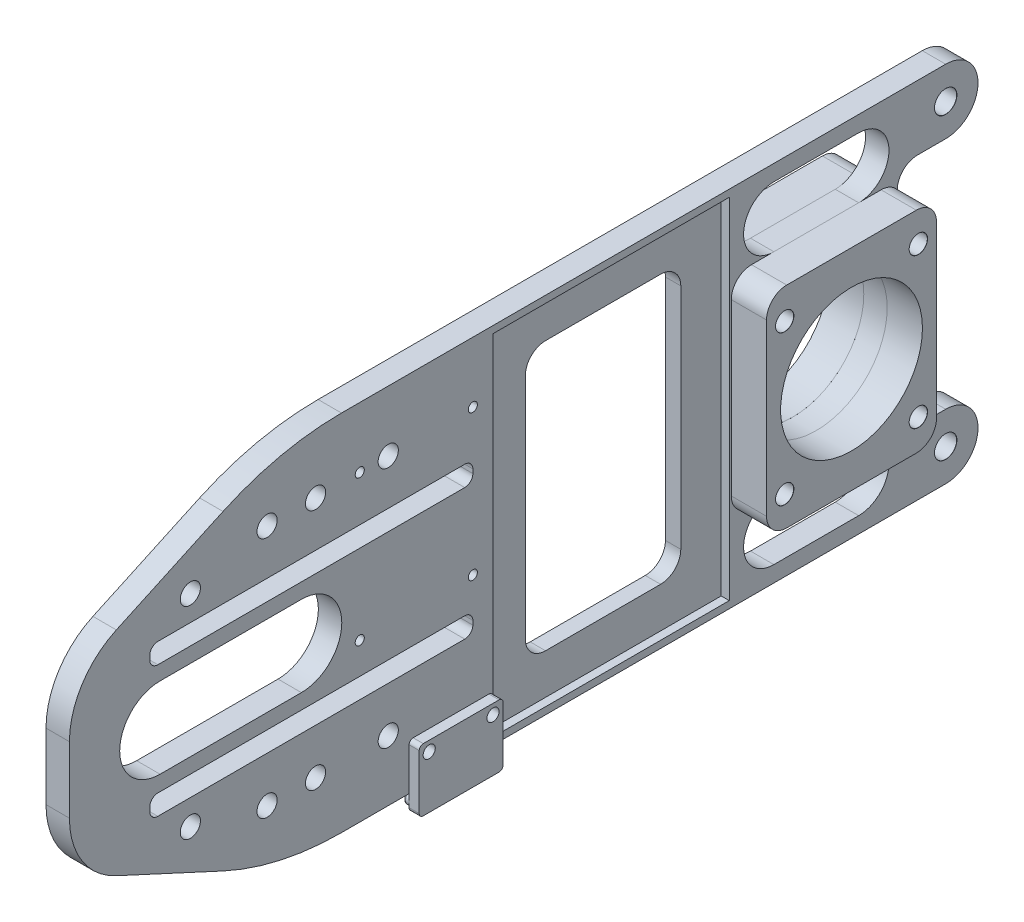
from build123d import *

# Parameters (mm, degrees)
SKETCH1_W                            = 90
SKETCH1_H                            = 225
SKETCH1_R                            = 17.5641
BOSS_EXTRUDE1_DEPTH                  = 2.9
SKETCH2_W                            = 52.1
SKETCH2_H                            = 42.1
BOSS_EXTRUDE2_DEPTH                  = 8.73125
M4_CLEARANCE_HOLE2_AT_2_COUNT        = 2
M4_CLEARANCE_HOLE2_AT_2_PITCH        = 33.1
M4_CLEARANCE_HOLE2_AT_3_COUNT        = 2
M4_CLEARANCE_HOLE2_AT_3_PITCH        = 49.719412708
M4_CLEARANCE_HOLE2_AT_4_COUNT        = 2
M4_CLEARANCE_HOLE2_AT_4_PITCH        = 37.1
SKETCH24_W                           = 52.1
SKETCH24_H                           = 42.1
BOSS_EXTRUDE3_DEPTH                  = 8.73125
TAP_DRILL_FOR_M4X0_7_TAP1_AT_2_COUNT = 2
TAP_DRILL_FOR_M4X0_7_TAP1_AT_2_PITCH = 33.1
TAP_DRILL_FOR_M4X0_7_TAP1_AT_3_COUNT = 2
TAP_DRILL_FOR_M4X0_7_TAP1_AT_3_PITCH = 49.719412708
TAP_DRILL_FOR_M4X0_7_TAP1_AT_4_COUNT = 2
TAP_DRILL_FOR_M4X0_7_TAP1_AT_4_PITCH = 37.1
TAP_DRILL_FOR_M3X0_5_TAP1_AT_2_COUNT = 2
TAP_DRILL_FOR_M3X0_5_TAP1_AT_2_PITCH = 15.8
SKETCH3_R                            = 17.5641
CUT_EXTRUDE3_DEPTH                   = 192.761952447
M5_CLEARANCE_HOLE1_AT_2_COUNT        = 2
M5_CLEARANCE_HOLE1_AT_2_PITCH        = 74
SKETCH14_W                           = 86.5
SKETCH14_H                           = 58.5
CUT_EXTRUDE4_DEPTH                   = 2
FILLET4_R                            = 8
FILLET5_R                            = 5
FILLET6_R                            = 5
SKETCH28_W                           = 15.5
SKETCH28_H                           = 20.75
SKETCH28_R                           = 1.5
BOSS_EXTRUDE4_DEPTH                  = 2.5
FILLET7_R                            = 1
SKETCH29_R                           = 1.5
BOSS_EXTRUDE5_DEPTH                  = 1.5
FILLET8_R                            = 0.5
SKETCH34_W                           = 1.1303
SKETCH34_H                           = 14.53125
TAP_DRILL_FOR_4_40_TAP1_AT_2_COUNT   = 2
TAP_DRILL_FOR_4_40_TAP1_AT_2_PITCH   = 28
TAP_DRILL_FOR_4_40_TAP1_AT_3_COUNT   = 2
TAP_DRILL_FOR_4_40_TAP1_AT_3_PITCH   = 45.607017004
TAP_DRILL_FOR_4_40_TAP1_AT_4_COUNT   = 2
TAP_DRILL_FOR_4_40_TAP1_AT_4_PITCH   = 36
CUT_EXTRUDE7_DEPTH                   = 192.888275701
CUT_EXTRUDE7_DEPTH_BACK              = 192.888275701
CUT_EXTRUDE8_DEPTH                   = 192.888275701
CUT_EXTRUDE11_DEPTH                  = 192.690477337
CUT_EXTRUDE11_DEPTH_BACK             = 192.690477337
SKETCH43_R                           = 2.5
FILLET12_R                           = 70
FILLET13_R                           = 20


with BuildPart() as part:
    # Sketch1 → Boss-Extrude1 (new, symmetric)
    with BuildSketch(Plane.YZ):
        with Locations((0, 72.45)):
            Rectangle(SKETCH1_W, SKETCH1_H)
        Circle(SKETCH1_R, mode=Mode.SUBTRACT)
    extrude(amount=BOSS_EXTRUDE1_DEPTH, both=True)


with BuildPart() as body_2:
    # Sketch2 → Boss-Extrude2 (new body)
    with BuildSketch(Plane.YZ.offset(2.9)):
        Rectangle(SKETCH2_W, SKETCH2_H)
    extrude(amount=BOSS_EXTRUDE2_DEPTH)


with BuildPart() as m4_clearance_hole2_tool:
    # Sketch23 → M4 Clearance Hole2 (revolve)
    with BuildSketch(Plane(origin=(11.63125, -18.55, 16.55), x_dir=(0, 0, -1), z_dir=(0, 1, 0))):
        Polygon((0, 0), (0, 14.53125), (2.25, 14.53125), (2.25, 0.025), (2.275, 0), align=None)
    m4_clearance_hole2 = revolve(axis=Axis((17.98125, -18.55, 16.55), (-1, 0, 0)))


with BuildPart() as part_1:
    add(part.part)

    # M4 Clearance Hole2: cut by m4_clearance_hole2_tool
    add(m4_clearance_hole2_tool.part, mode=Mode.SUBTRACT)


with BuildPart() as body_2_1:
    add(body_2.part)

    # M4 Clearance Hole2: cut by m4_clearance_hole2_tool
    add(m4_clearance_hole2_tool.part, mode=Mode.SUBTRACT)


with BuildPart() as m4_clearance_hole2_at_2_tool:
    # M4 Clearance Hole2 at 2: M4 Clearance Hole2 ×2
    with Locations(*[(0, 0, -i * M4_CLEARANCE_HOLE2_AT_2_PITCH) for i in range(1, M4_CLEARANCE_HOLE2_AT_2_COUNT)]):
        add(m4_clearance_hole2)


with BuildPart() as part_2:
    add(part_1.part)

    # M4 Clearance Hole2 at 2: cut by m4_clearance_hole2_at_2_tool
    add(m4_clearance_hole2_at_2_tool.part, mode=Mode.SUBTRACT)


with BuildPart() as body_2_2:
    add(body_2_1.part)

    # M4 Clearance Hole2 at 2: cut by m4_clearance_hole2_at_2_tool
    add(m4_clearance_hole2_at_2_tool.part, mode=Mode.SUBTRACT)


with BuildPart() as m4_clearance_hole2_at_3_tool:
    # M4 Clearance Hole2 at 3: M4 Clearance Hole2 ×2
    with Locations(*[Vector(0, 0.7461874141213228, -0.6657359409006949) * (i * M4_CLEARANCE_HOLE2_AT_3_PITCH) for i in range(1, M4_CLEARANCE_HOLE2_AT_3_COUNT)]):
        add(m4_clearance_hole2)


with BuildPart() as part_3:
    add(part_2.part)

    # M4 Clearance Hole2 at 3: cut by m4_clearance_hole2_at_3_tool
    add(m4_clearance_hole2_at_3_tool.part, mode=Mode.SUBTRACT)


with BuildPart() as body_2_3:
    add(body_2_2.part)

    # M4 Clearance Hole2 at 3: cut by m4_clearance_hole2_at_3_tool
    add(m4_clearance_hole2_at_3_tool.part, mode=Mode.SUBTRACT)


with BuildPart() as m4_clearance_hole2_at_4_tool:
    # M4 Clearance Hole2 at 4: M4 Clearance Hole2 ×2
    with Locations(*[(0, i * M4_CLEARANCE_HOLE2_AT_4_PITCH, 0) for i in range(1, M4_CLEARANCE_HOLE2_AT_4_COUNT)]):
        add(m4_clearance_hole2)


with BuildPart() as part_4:
    add(part_3.part)

    # M4 Clearance Hole2 at 4: cut by m4_clearance_hole2_at_4_tool
    add(m4_clearance_hole2_at_4_tool.part, mode=Mode.SUBTRACT)

    # Sketch10 → Tap Drill for M3x0.5 Tap1 (revolve, cut)
    with BuildSketch(Plane(origin=(2.9, -36, 98.35), x_dir=(0, 0, -1), z_dir=(0, 1, 0))):
        Polygon((0, 0), (0, 14.53125), (1.25, 14.53125), (1.25, 0.025), (1.275, 0), align=None)
    tap_drill_for_m3x0_5_tap1 = revolve(axis=Axis((9.25, -36, 98.35), (-1, 0, 0)), mode=Mode.SUBTRACT)

    # Tap Drill for M3x0.5 Tap1 at 2: Tap Drill for M3x0.5 Tap1 ×2
    with Locations(*[(0, 0, -i * TAP_DRILL_FOR_M3X0_5_TAP1_AT_2_PITCH) for i in range(1, TAP_DRILL_FOR_M3X0_5_TAP1_AT_2_COUNT)]):
        add(tap_drill_for_m3x0_5_tap1, mode=Mode.SUBTRACT)

    # Sketch12 → M5 Clearance Hole1 (revolve, cut)
    with BuildSketch(Plane(origin=(2.9, -37, -32.05), x_dir=(0, 0, -1), z_dir=(0, 1, 0))):
        Polygon((0, 0), (0, 14.53125), (2.75, 14.53125), (2.75, 0.025), (2.775, 0), align=None)
    m5_clearance_hole1 = revolve(axis=Axis((9.25, -37, -32.05), (-1, 0, 0)), mode=Mode.SUBTRACT)

    # M5 Clearance Hole1 at 2: M5 Clearance Hole1 ×2
    with Locations(*[(0, i * M5_CLEARANCE_HOLE1_AT_2_PITCH, 0) for i in range(1, M5_CLEARANCE_HOLE1_AT_2_COUNT)]):
        add(m5_clearance_hole1, mode=Mode.SUBTRACT)

    # Sketch14 → Cut-Extrude4 (cut)
    with BuildSketch(Plane.YZ.offset(2.9)):
        with Locations((0, 50.8)):
            Rectangle(SKETCH14_W, SKETCH14_H)
    extrude(amount=-CUT_EXTRUDE4_DEPTH, mode=Mode.SUBTRACT)

    # Fillet4
    fillet4_edges = [part_4.edges().sort_by_distance(p)[0] for p in [
        (0, 45, -40.05),
        (0, -45, -40.05),
        (0, 45, 184.95),
        (0, -45, 184.95),
    ]]
    fillet(fillet4_edges, radius=FILLET4_R)

    # Sketch34 → Tap Drill for #4-40 Tap1 (revolve, cut)
    with BuildSketch(Plane(origin=(2.9, -6, 113.05), x_dir=(0, 0, -1), z_dir=(0, 1, 0))):
        with Locations((0.56515, 7.265625)):
            Rectangle(SKETCH34_W, SKETCH34_H)
    tap_drill_for_4_40_tap1 = revolve(axis=Axis((9.25, -6, 113.05), (-1, 0, 0)), mode=Mode.SUBTRACT)

    # Tap Drill for #4-40 Tap1 at 2: Tap Drill for #4-40 Tap1 ×2
    with Locations(*[(0, 0, -i * TAP_DRILL_FOR_4_40_TAP1_AT_2_PITCH) for i in range(1, TAP_DRILL_FOR_4_40_TAP1_AT_2_COUNT)]):
        add(tap_drill_for_4_40_tap1, mode=Mode.SUBTRACT)

    # Tap Drill for #4-40 Tap1 at 3: Tap Drill for #4-40 Tap1 ×2
    with Locations(*[Vector(0, 0.7893522173763263, -0.6139406135149206) * (i * TAP_DRILL_FOR_4_40_TAP1_AT_3_PITCH) for i in range(1, TAP_DRILL_FOR_4_40_TAP1_AT_3_COUNT)]):
        add(tap_drill_for_4_40_tap1, mode=Mode.SUBTRACT)

    # Tap Drill for #4-40 Tap1 at 4: Tap Drill for #4-40 Tap1 ×2
    with Locations(*[(0, i * TAP_DRILL_FOR_4_40_TAP1_AT_4_PITCH, 0) for i in range(1, TAP_DRILL_FOR_4_40_TAP1_AT_4_COUNT)]):
        add(tap_drill_for_4_40_tap1, mode=Mode.SUBTRACT)

    # Sketch37 → Cut-Extrude7 (cut, two sides: drawn at the far end of the back side and taken through both)
    with BuildSketch(Plane.YZ.offset(2.9).offset(-CUT_EXTRUDE7_DEPTH_BACK)):
        with BuildLine():
            Line((-16.75, 165.05), (-15.75, 165.05))
            ThreePointArc((-15.75, 165.05), (-14.335786438, 164.464213562), (-13.75, 163.05))
            Line((-13.75, 163.05), (-13.75, 87.05))
            ThreePointArc((-13.75, 87.05), (-14.335786438, 85.635786438), (-15.75, 85.05))
            Line((-15.75, 85.05), (-16.75, 85.05))
            ThreePointArc((-16.75, 85.05), (-18.164213562, 85.635786438), (-18.75, 87.05))
            Line((-18.75, 87.05), (-18.75, 163.05))
            ThreePointArc((-18.75, 163.05), (-18.164213562, 164.464213562), (-16.75, 165.05))
        make_face()
        with BuildLine():
            Line((13.75, 163.05), (13.75, 87.05))
            ThreePointArc((13.75, 87.05), (14.335786438, 85.635786438), (15.75, 85.05))
            Line((15.75, 85.05), (16.75, 85.05))
            ThreePointArc((16.75, 85.05), (18.164213562, 85.635786438), (18.75, 87.05))
            Line((18.75, 87.05), (18.75, 163.05))
            ThreePointArc((18.75, 163.05), (18.164213562, 164.464213562), (16.75, 165.05))
            Line((16.75, 165.05), (15.75, 165.05))
            ThreePointArc((15.75, 165.05), (14.335786438, 164.464213562), (13.75, 163.05))
        make_face()
    extrude(amount=CUT_EXTRUDE7_DEPTH + CUT_EXTRUDE7_DEPTH_BACK, mode=Mode.SUBTRACT)

    # Sketch38 → Cut-Extrude8 (cut, through all)
    with BuildSketch(Plane.YZ.offset(2.9)):
        with BuildLine():
            ThreePointArc((-33.25, 36.55), (-31.785533906, 33.014466094), (-28.25, 31.55))
            Line((-28.25, 31.55), (28.25, 31.55))
            ThreePointArc((28.25, 31.55), (31.785533906, 33.014466094), (33.25, 36.55))
            Line((33.25, 36.55), (33.25, 65.05))
            ThreePointArc((33.25, 65.05), (31.785533906, 68.585533906), (28.25, 70.05))
            Line((28.25, 70.05), (-28.25, 70.05))
            ThreePointArc((-28.25, 70.05), (-31.785533906, 68.585533906), (-33.25, 65.05))
            Line((-33.25, 65.05), (-33.25, 36.55))
        make_face()
        with BuildLine():
            ThreePointArc((-24, -20.05), (-27.535533906, -21.514466094), (-29, -25.05))
            Line((-29, -25.05), (-29, -32.05))
            ThreePointArc((-29, -32.05), (-31.343145751, -37.706854249), (-37, -40.05))
            Line((-37, -40.05), (37, -40.05))
            ThreePointArc((37, -40.05), (31.343145751, -37.706854249), (29, -32.05))
            Line((29, -32.05), (29, -25.05))
            ThreePointArc((29, -25.05), (27.535533906, -21.514466094), (24, -20.05))
            Line((24, -20.05), (-24, -20.05))
        make_face()
    extrude(amount=-CUT_EXTRUDE8_DEPTH, mode=Mode.SUBTRACT)

    # Sketch43 → Cut-Extrude11 (cut, two sides: drawn at the far end of the back side and taken through both)
    with BuildSketch(Plane.YZ.offset(-CUT_EXTRUDE11_DEPTH_BACK)):
        with Locations((-25, 155)):
            Circle(SKETCH43_R)
        with Locations((-30, 136)):
            Circle(SKETCH43_R)
        with Locations((-30, 106)):
            Circle(SKETCH43_R)
        with Locations((-30, 124)):
            Circle(SKETCH43_R)
        with Locations((30, 124)):
            Circle(SKETCH43_R)
        with Locations((30, 106)):
            Circle(SKETCH43_R)
        with Locations((30, 136)):
            Circle(SKETCH43_R)
        with Locations((25, 155)):
            Circle(SKETCH43_R)
        with BuildLine():
            Line((-26.05, 10.5), (-26.05, -10.5))
            ThreePointArc((-26.05, -10.5), (-33.55, -18), (-41.05, -10.5))
            Line((-41.05, -10.5), (-41.05, 10.5))
            ThreePointArc((-41.05, 10.5), (-33.55, 18), (-26.05, 10.5))
        make_face()
        with BuildLine():
            Line((10, 162.5), (10, 127.5))
            ThreePointArc((10, 127.5), (0, 117.5), (-10, 127.5))
            Line((-10, 127.5), (-10, 162.5))
            ThreePointArc((-10, 162.5), (0, 172.5), (10, 162.5))
        make_face()
        with BuildLine():
            Line((26.05, 10.5), (26.05, -10.5))
            ThreePointArc((26.05, -10.5), (33.55, -18), (41.05, -10.5))
            Line((41.05, -10.5), (41.05, 10.5))
            ThreePointArc((41.05, 10.5), (33.55, 18), (26.05, 10.5))
        make_face()
        Polygon((-45, 132.95), (-21, 184.95), (-45, 184.95), align=None)
        Polygon((21, 184.95), (45, 184.95), (45, 132.95), align=None)
    extrude(amount=CUT_EXTRUDE11_DEPTH + CUT_EXTRUDE11_DEPTH_BACK, mode=Mode.SUBTRACT)

    # Fillet12
    fillet12_edges = [part_4.edges().sort_by_distance(p)[0] for p in [
        (0, 45, 132.95),
        (0, -45, 132.95),
    ]]
    fillet(fillet12_edges, radius=FILLET12_R)

    # Fillet13
    fillet13_edges = [part_4.edges().sort_by_distance(p)[0] for p in [
        (0, 21, 184.95),
        (0, -21, 184.95),
    ]]
    fillet(fillet13_edges, radius=FILLET13_R)


with BuildPart() as body_2_4:
    add(body_2_3.part)

    # M4 Clearance Hole2 at 4: cut by m4_clearance_hole2_at_4_tool
    add(m4_clearance_hole2_at_4_tool.part, mode=Mode.SUBTRACT)


with BuildPart() as body_3:
    # Sketch24 → Boss-Extrude3 (new body)
    with BuildSketch(Plane(origin=(-2.9, 0, 0), x_dir=(0, -1, 0), z_dir=(-1, 0, 0))):
        Rectangle(SKETCH24_W, SKETCH24_H)
    extrude(amount=BOSS_EXTRUDE3_DEPTH)

    # Sketch27 → Tap Drill for M4x0.7 Tap1 (revolve, cut)
    with BuildSketch(Plane(origin=(-11.63125, 18.55, 16.55), x_dir=(0, 0, 1), z_dir=(0, 1, 0))):
        Polygon((0, 0), (0, 9.722670021), (1.65, 8.73125), (1.65, 0.025), (1.675, 0), align=None)
    tap_drill_for_m4x0_7_tap1 = revolve(axis=Axis((-17.98125, 18.55, 16.55), (1, 0, 0)), mode=Mode.SUBTRACT)

    # Tap Drill for M4x0.7 Tap1 at 2: Tap Drill for M4x0.7 Tap1 ×2
    with Locations(*[(0, 0, -i * TAP_DRILL_FOR_M4X0_7_TAP1_AT_2_PITCH) for i in range(1, TAP_DRILL_FOR_M4X0_7_TAP1_AT_2_COUNT)]):
        add(tap_drill_for_m4x0_7_tap1, mode=Mode.SUBTRACT)

    # Tap Drill for M4x0.7 Tap1 at 3: Tap Drill for M4x0.7 Tap1 ×2
    with Locations(*[Vector(0, -0.7461874141213228, -0.6657359409006949) * (i * TAP_DRILL_FOR_M4X0_7_TAP1_AT_3_PITCH) for i in range(1, TAP_DRILL_FOR_M4X0_7_TAP1_AT_3_COUNT)]):
        add(tap_drill_for_m4x0_7_tap1, mode=Mode.SUBTRACT)

    # Tap Drill for M4x0.7 Tap1 at 4: Tap Drill for M4x0.7 Tap1 ×2
    with Locations(*[(0, -i * TAP_DRILL_FOR_M4X0_7_TAP1_AT_4_PITCH, 0) for i in range(1, TAP_DRILL_FOR_M4X0_7_TAP1_AT_4_COUNT)]):
        add(tap_drill_for_m4x0_7_tap1, mode=Mode.SUBTRACT)


with BuildPart() as cut_extrude3_tool:
    # Sketch3 → Cut-Extrude3 (new, through all)
    with BuildSketch(Plane.YZ.offset(11.63125)):
        Circle(SKETCH3_R)
    extrude(amount=-CUT_EXTRUDE3_DEPTH)


with BuildPart() as body_2_5:
    add(body_2_4.part)

    # Cut-Extrude3: cut by cut_extrude3_tool
    add(cut_extrude3_tool.part, mode=Mode.SUBTRACT)

    # Fillet6
    fillet6_edges = [body_2_5.edges().sort_by_distance(p)[0] for p in [
        (7.265625, -26.05, 21.05),
        (7.265625, 26.05, -21.05),
        (7.265625, -26.05, -21.05),
        (7.265625, 26.05, 21.05),
    ]]
    fillet(fillet6_edges, radius=FILLET6_R)


with BuildPart() as body_3_1:
    add(body_3.part)

    # Cut-Extrude3: cut by cut_extrude3_tool
    add(cut_extrude3_tool.part, mode=Mode.SUBTRACT)

    # Fillet5
    fillet5_edges = [body_3_1.edges().sort_by_distance(p)[0] for p in [
        (-7.265625, -26.05, 21.05),
        (-7.265625, -26.05, -21.05),
        (-7.265625, 26.05, -21.05),
        (-7.265625, 26.05, 21.05),
    ]]
    fillet(fillet5_edges, radius=FILLET5_R)


with BuildPart() as body_4:
    # Sketch28 → Boss-Extrude4 (new body)
    with BuildSketch(Plane.YZ.offset(2.9)):
        with Locations((-41.275, 90.45)):
            Rectangle(SKETCH28_W, SKETCH28_H)
        with Locations((-36, 82.55)):
            Circle(SKETCH28_R, mode=Mode.SUBTRACT)
        with Locations((-36, 98.35)):
            Circle(SKETCH28_R, mode=Mode.SUBTRACT)
    extrude(amount=BOSS_EXTRUDE4_DEPTH)

    # Fillet7
    fillet7_edges = [body_4.edges().sort_by_distance(p)[0] for p in [
        (4.15, -33.525, 100.825),
        (4.15, -33.525, 80.075),
        (4.15, -49.025, 80.075),
        (4.15, -49.025, 100.825),
    ]]
    fillet(fillet7_edges, radius=FILLET7_R)

    # Sketch29 → Boss-Extrude5 (add)
    with BuildSketch(Plane(origin=(2.9, 0, 0), x_dir=(0, -1, 0), z_dir=(-1, 0, 0))):
        with Locations((47.025, 99.2)):
            Circle(SKETCH29_R)
        with Locations((47.025, 95.7)):
            Circle(SKETCH29_R)
        with Locations((47.025, 92.2)):
            Circle(SKETCH29_R)
        with Locations((47.025, 88.7)):
            Circle(SKETCH29_R)
        with Locations((47.025, 85.2)):
            Circle(SKETCH29_R)
        with Locations((47.025, 81.7)):
            Circle(SKETCH29_R)
    extrude(amount=BOSS_EXTRUDE5_DEPTH)

    # Fillet8
    fillet8_edges = [body_4.edges().sort_by_distance(p)[0] for p in [
        (1.4, -45.525, 81.7),
        (1.4, -45.525, 85.2),
        (1.4, -45.525, 88.7),
        (1.4, -45.525, 92.2),
        (1.4, -45.525, 95.7),
        (1.4, -45.525, 99.2),
    ]]
    fillet(fillet8_edges, radius=FILLET8_R)


solid = Compound([part_4.part, body_2_5.part, body_3_1.part, body_4.part])
